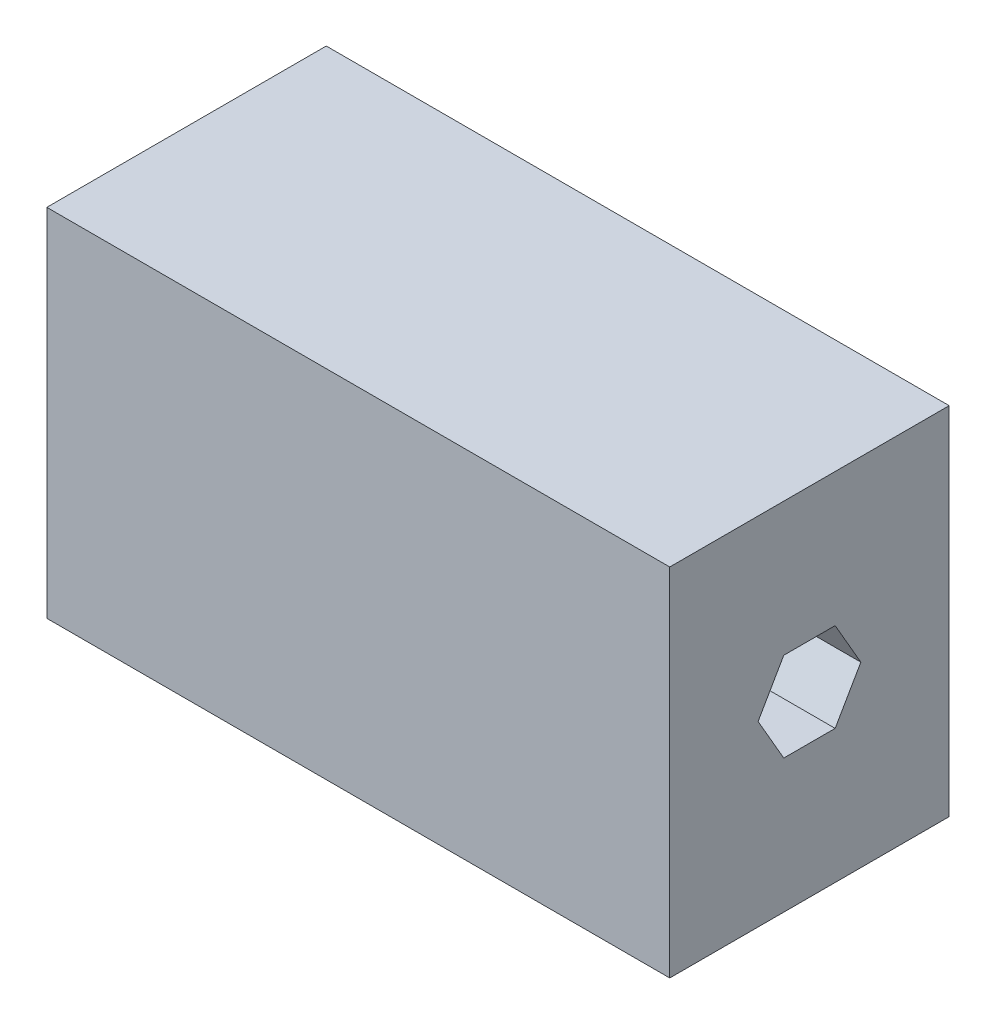
from build123d import *

# Parameters (mm, degrees)
SKETCH1_W           = 39.878
SKETCH1_H           = 50.8
BOSS_EXTRUDE1_DEPTH = 88.9
CUT_EXTRUDE2_DEPTH  = 95.582946248


with BuildPart() as part:
    # Sketch1 → Boss-Extrude1 (new body)
    with BuildSketch(Plane(origin=(0, 0, 0), x_dir=(0, 0, -1), z_dir=(1, 0, 0))):
        Rectangle(SKETCH1_W, SKETCH1_H)
    extrude(amount=BOSS_EXTRUDE1_DEPTH)

    # Sketch3 → Cut-Extrude2 (cut, through all)
    with BuildSketch(Plane(origin=(88.9, 0, 0), x_dir=(0, 0, -1), z_dir=(1, 0, 0))):
        Polygon((7.332348419, 0), (3.666174209, 6.35), (-3.666174209, 6.35), (-7.332348419, 0), (-3.666174209, -6.35), (3.666174209, -6.35), align=None)
    extrude(amount=-CUT_EXTRUDE2_DEPTH, mode=Mode.SUBTRACT)


solid = part.part
